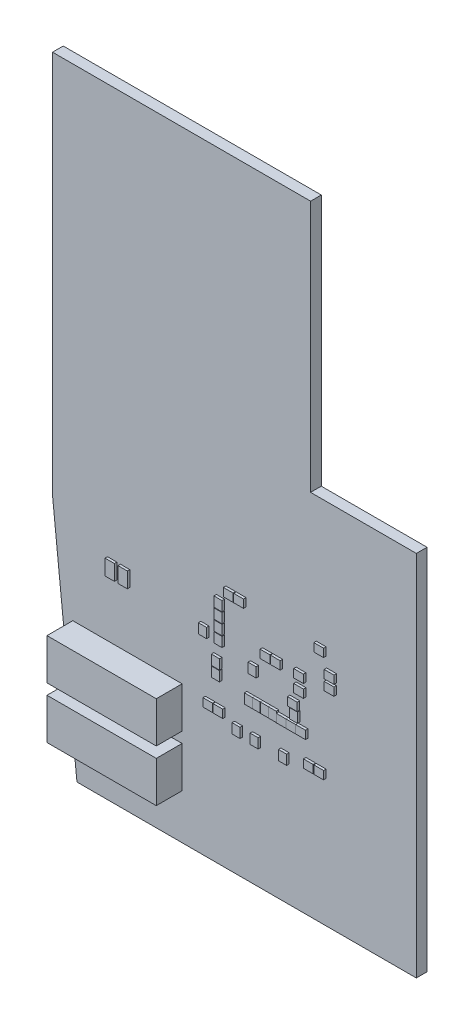
from build123d import *

# Parameters (mm, degrees)
BOARD_DEPTH                   = 2.6289
SKETCH2_W                     = 27.999944
SKETCH2_H                     = 27.999944
PBGA_324P_1MM_1_DEPTH         = 2.549906
SKETCH5_W                     = 7.20344
SKETCH5_H                     = 10.203434
SOT_223_1_DEPTH               = 1.778
SKETCH8_W                     = 12.003278
SKETCH8_H                     = 11.703304
HTSSOP_32P_0_65_1_DEPTH       = 2.649982
SKETCH53_W                    = 8.203184
SKETCH53_H                    = 5.803138
TSSOP_14P_0_65_1_DEPTH        = 1.100074
SKETCH54_W                    = 8.203184
SKETCH54_H                    = 5.803138
TSSOP_14P_0_65_2_DEPTH        = 1.100074
SKETCH57_W                    = 11.699748
SKETCH57_H                    = 9.699752
BGA_48P_0_8_1_DEPTH           = 0.999998
SKETCH58_W                    = 11.699748
SKETCH58_H                    = 9.699752
FBGA_48P_0_75_S_1_DEPTH       = 1.199896
SKETCH59_W                    = 13.700252
SKETCH59_H                    = 13.700252
FBGA_48P_0_75_1_DEPTH         = 1.35001
SKETCH60_W                    = 13.999972
SKETCH60_H                    = 13.999972
TFBGA_128P_0_8_1_DEPTH        = 1.199896
SKETCH62_W                    = 5.84327
SKETCH62_H                    = 8.279384
SO8_1_DEPTH                   = 1.75006
SKETCH66_W                    = 15.003272
SKETCH66_H                    = 14.203172
TQFP_44P_0_8_1_DEPTH          = 1.199896
SKETCH68_W                    = 5.84327
SKETCH68_H                    = 8.279384
SO8_2_DEPTH                   = 1.75006
SKETCH79_W                    = 13.999972
SKETCH79_H                    = 13.999972
TFBGA_128P_0_8_2_DEPTH        = 1.199896
SKETCH106_W                   = 8.279384
SKETCH106_H                   = 5.84327
SO8_3_DEPTH                   = 1.75006
SKETCH140_W                   = 3.854196
SKETCH140_H                   = 8.970264
TSSOP_8P_0_65_1_DEPTH         = 1.199896
SKETCH150_W                   = 7.403338
SKETCH150_H                   = 8.453374
TSSOP_20_0_65_1_DEPTH         = 1.199896
SKETCH151_W                   = 3.70332
SKETCH151_H                   = 6.703314
MSOP_10P_0_5_1_DEPTH          = 1.100074
SKETCH164_W                   = 42.203116
SKETCH164_H                   = 9.003284
CON_80P_0_8MM_QSE_SOC_1_DEPTH = 3.048
SKETCH165_W                   = 42.203116
SKETCH165_H                   = 9.003284
CON_80P_0_8MM_QSE_SOC_2_DEPTH = 3.048
CON_10P_100_RA_1_DEPTH        = 4.826
SKETCH171_W                   = 14.1732
SKETCH171_H                   = 19.8882
CON_14P_100_RA_1_DEPTH        = 4.826
SKETCH172_W                   = 14.203172
SKETCH172_H                   = 7.703312
DPAK_1_DEPTH                  = 2.54
SKETCH173_W                   = 7.703312
SKETCH173_H                   = 14.203172
DPAK_2_DEPTH                  = 2.54
SKETCH174_W                   = 6.453378
SKETCH174_H                   = 3.753358
MSOP_8P_0_65_1_DEPTH          = 1.100074
SKETCH175_W                   = 6.453378
SKETCH175_H                   = 3.753358
MSOP_8P_0_65_2_DEPTH          = 1.100074
SKETCH176_W                   = 6.453378
SKETCH176_H                   = 3.753358
MSOP_8P_0_65_3_DEPTH          = 1.100074
SKETCH177_W                   = 6.453378
SKETCH177_H                   = 3.753358
MSOP_8P_0_65_4_DEPTH          = 1.100074
SKETCH179_W                   = 8.279384
SKETCH179_H                   = 5.84327
SO8_4_DEPTH                   = 1.75006
SKETCH180_W                   = 2.303272
SKETCH180_H                   = 3.803396
SOT_553_5P_1_DEPTH            = 0.599948
SKETCH181_W                   = 2.303272
SKETCH181_H                   = 3.803396
SOT_553_5P_2_DEPTH            = 0.599948
SKETCH192_W                   = 4.903216
SKETCH192_H                   = 3.05308
RP_0402_16P_1_DEPTH           = 0.54991
SKETCH193_W                   = 4.903216
SKETCH193_H                   = 3.05308
RP_0402_16P_2_DEPTH           = 0.54991
SKETCH194_W                   = 3.05308
SKETCH194_H                   = 4.903216
RP_0402_16P_3_DEPTH           = 0.54991
SKETCH195_W                   = 3.05308
SKETCH195_H                   = 4.903216
RP_0402_16P_4_DEPTH           = 0.54991
SKETCH196_W                   = 3.05308
SKETCH196_H                   = 4.903216
RP_0402_16P_5_DEPTH           = 0.54991
SKETCH200_W                   = 7.403338
SKETCH200_H                   = 8.453374
TSSOP_20_0_65_2_DEPTH         = 1.199896
SKETCH201_W                   = 7.403338
SKETCH201_H                   = 8.453374
TSSOP_20_0_65_3_DEPTH         = 1.199896
SKETCH202_W                   = 7.403338
SKETCH202_H                   = 8.453374
TSSOP_20_0_65_4_DEPTH         = 1.199896
SKETCH203_W                   = 7.403338
SKETCH203_H                   = 8.453374
TSSOP_20_0_65_5_DEPTH         = 1.199896
SKETCH333_W                   = 2.003044
SKETCH333_H                   = 2.403348
EXTRUDE_C0306_1_DEPTH         = 0.610108
SKETCH334_W                   = 2.403348
SKETCH334_H                   = 2.003044
EXTRUDE_C0306_2_DEPTH         = 0.610108
SKETCH335_W                   = 2.403348
SKETCH335_H                   = 2.003044
EXTRUDE_C0306_3_DEPTH         = 0.610108
SKETCH336_W                   = 2.003044
SKETCH336_H                   = 2.403348
EXTRUDE_C0306_4_DEPTH         = 0.610108
SKETCH337_W                   = 2.003044
SKETCH337_H                   = 2.403348
EXTRUDE_C0306_5_DEPTH         = 0.610108
SKETCH338_W                   = 2.003044
SKETCH338_H                   = 2.403348
EXTRUDE_C0306_6_DEPTH         = 0.610108
SKETCH339_W                   = 2.003044
SKETCH339_H                   = 2.403348
EXTRUDE_C0306_7_DEPTH         = 0.610108
SKETCH340_W                   = 2.403348
SKETCH340_H                   = 2.003044
EXTRUDE_C0306_8_DEPTH         = 0.610108
SKETCH341_W                   = 2.403348
SKETCH341_H                   = 2.003044
EXTRUDE_C0306_9_DEPTH         = 0.610108
SKETCH342_W                   = 2.403348
SKETCH342_H                   = 2.003044
EXTRUDE_C0306_10_DEPTH        = 0.610108
SKETCH343_W                   = 2.003044
SKETCH343_H                   = 2.403348
EXTRUDE_C0306_11_DEPTH        = 0.610108
SKETCH344_W                   = 2.003044
SKETCH344_H                   = 2.403348
EXTRUDE_C0306_12_DEPTH        = 0.610108
SKETCH345_W                   = 2.403348
SKETCH345_H                   = 2.003044
EXTRUDE_C0306_13_DEPTH        = 0.610108
SKETCH346_W                   = 2.003044
SKETCH346_H                   = 2.403348
EXTRUDE_C0306_14_DEPTH        = 0.610108
SKETCH347_W                   = 2.003044
SKETCH347_H                   = 2.403348
EXTRUDE_C0306_15_DEPTH        = 0.610108
SKETCH348_W                   = 2.003044
SKETCH348_H                   = 2.403348
EXTRUDE_C0306_16_DEPTH        = 0.610108
SKETCH349_W                   = 2.403348
SKETCH349_H                   = 2.003044
EXTRUDE_C0306_17_DEPTH        = 0.610108
SKETCH350_W                   = 2.403348
SKETCH350_H                   = 2.003044
EXTRUDE_C0306_18_DEPTH        = 0.610108
SKETCH351_W                   = 2.403348
SKETCH351_H                   = 2.003044
EXTRUDE_C0306_19_DEPTH        = 0.610108
SKETCH352_W                   = 2.003044
SKETCH352_H                   = 2.403348
EXTRUDE_C0306_20_DEPTH        = 0.610108
SKETCH353_W                   = 2.403348
SKETCH353_H                   = 2.003044
EXTRUDE_C0306_21_DEPTH        = 0.610108
SKETCH354_W                   = 2.003044
SKETCH354_H                   = 2.403348
EXTRUDE_C0306_22_DEPTH        = 0.610108
SKETCH355_W                   = 2.403348
SKETCH355_H                   = 2.003044
EXTRUDE_C0306_23_DEPTH        = 0.610108
SKETCH356_W                   = 2.403348
SKETCH356_H                   = 2.003044
EXTRUDE_C0306_24_DEPTH        = 0.610108
SKETCH357_W                   = 2.403348
SKETCH357_H                   = 2.003044
EXTRUDE_C0306_25_DEPTH        = 0.610108
SKETCH358_W                   = 2.403348
SKETCH358_H                   = 2.003044
EXTRUDE_C0306_26_DEPTH        = 0.610108
SKETCH359_W                   = 2.403348
SKETCH359_H                   = 2.003044
EXTRUDE_C0306_27_DEPTH        = 0.610108
SKETCH360_W                   = 2.403348
SKETCH360_H                   = 2.003044
EXTRUDE_C0306_28_DEPTH        = 0.610108
SKETCH361_W                   = 2.403348
SKETCH361_H                   = 2.003044
EXTRUDE_C0306_29_DEPTH        = 0.610108
SKETCH362_W                   = 2.003044
SKETCH362_H                   = 2.403348
EXTRUDE_C0306_30_DEPTH        = 0.610108
SKETCH363_W                   = 2.003044
SKETCH363_H                   = 2.403348
EXTRUDE_C0306_31_DEPTH        = 0.610108
SKETCH364_W                   = 2.003044
SKETCH364_H                   = 2.403348
EXTRUDE_C0306_32_DEPTH        = 0.610108
SKETCH365_W                   = 2.003044
SKETCH365_H                   = 2.403348
EXTRUDE_C0306_33_DEPTH        = 0.610108
SKETCH407_W                   = 8.279384
SKETCH407_H                   = 5.84327
SO8_5_DEPTH                   = 1.75006
CON_6P_100_RA_1_DEPTH         = 4.1148
SKETCH419_W                   = 26.8732
SKETCH419_H                   = 10.0711
CON_38P_25_TE_1_DEPTH         = 6.35
SKETCH420_W                   = 26.8732
SKETCH420_H                   = 10.0711
CON_38P_25_TE_2_DEPTH         = 6.35


with BuildPart() as part:
    # Sketch1 → BOARD (new body)
    with BuildSketch(Plane.XY):
        Polygon((0, 152.4), (0, 57.999884), (5.999988, 0), (89.440004, 0), (89.440004, 90.400124), (63.440056, 90.400124), (63.440056, 152.4), align=None)
    extrude(amount=BOARD_DEPTH)


with BuildPart() as body_2:
    # Sketch2 → PBGA_324P_1MM-1 (new body)
    with BuildSketch(Plane.XY):
        with Locations((54.99989, 44.99991)):
            Rectangle(SKETCH2_W, SKETCH2_H)
    extrude(amount=-PBGA_324P_1MM_1_DEPTH)


with BuildPart() as body_3:
    # Sketch5 → SOT-223-1 (new body)
    with BuildSketch(Plane.XY):
        with Locations((78.74, 69.731001)):
            Rectangle(SKETCH5_W, SKETCH5_H)
    extrude(amount=-SOT_223_1_DEPTH)


with BuildPart() as body_4:
    # Sketch8 → HTSSOP_32P_0_65-1 (new body)
    with BuildSketch(Plane.XY):
        with Locations((38.100127, 131.500118)):
            Rectangle(SKETCH8_W, SKETCH8_H)
    extrude(amount=-HTSSOP_32P_0_65_1_DEPTH)


with BuildPart() as body_5:
    # Sketch53 → TSSOP_14P_0_65-1 (new body)
    with BuildSketch(Plane.XY):
        with Locations((29.595064, 38.050089)):
            Rectangle(SKETCH53_W, SKETCH53_H)
    extrude(amount=-TSSOP_14P_0_65_1_DEPTH)


with BuildPart() as body_6:
    # Sketch54 → TSSOP_14P_0_65-2 (new body)
    with BuildSketch(Plane.XY):
        with Locations((29.595064, 27.255089)):
            Rectangle(SKETCH54_W, SKETCH54_H)
    extrude(amount=-TSSOP_14P_0_65_2_DEPTH)


with BuildPart() as body_7:
    # Sketch57 → BGA_48P_0_8-1 (new body)
    with BuildSketch(Plane.XY):
        with Locations((81.000092, 17.999964)):
            Rectangle(SKETCH57_W, SKETCH57_H)
    extrude(amount=-BGA_48P_0_8_1_DEPTH)


with BuildPart() as body_8:
    # Sketch58 → FBGA_48P_0_75_S-1 (new body)
    with BuildSketch(Plane.XY):
        with Locations((81.000092, 44.99991)):
            Rectangle(SKETCH58_W, SKETCH58_H)
    extrude(amount=-FBGA_48P_0_75_S_1_DEPTH)


with BuildPart() as body_9:
    # Sketch59 → FBGA_48P_0_75-1 (new body)
    with BuildSketch(Plane.XY):
        with Locations((81.000092, 31.999936)):
            Rectangle(SKETCH59_W, SKETCH59_H)
    extrude(amount=-FBGA_48P_0_75_1_DEPTH)


with BuildPart() as body_10:
    # Sketch60 → TFBGA_128P_0_8-1 (new body)
    with BuildSketch(Plane.XY):
        with Locations((28.999942, 77.0001)):
            Rectangle(SKETCH60_W, SKETCH60_H)
    extrude(amount=-TFBGA_128P_0_8_1_DEPTH)


with BuildPart() as body_11:
    # Sketch62 → SO8-1 (new body)
    with BuildSketch(Plane.XY):
        with Locations((5.995035, 93.497908)):
            Rectangle(SKETCH62_W, SKETCH62_H)
    extrude(amount=-SO8_1_DEPTH)


with BuildPart() as body_12:
    # Sketch66 → TQFP_44P_0_8-1 (new body)
    with BuildSketch(Plane.XY):
        with Locations((24.53005, 56.515)):
            Rectangle(SKETCH66_W, SKETCH66_H)
    extrude(amount=-TQFP_44P_0_8_1_DEPTH)


with BuildPart() as body_13:
    # Sketch68 → SO8-2 (new body)
    with BuildSketch(Plane.XY):
        with Locations((56.869965, 94.462092)):
            Rectangle(SKETCH68_W, SKETCH68_H)
    extrude(amount=-SO8_2_DEPTH)


with BuildPart() as body_14:
    # Sketch79 → TFBGA_128P_0_8-2 (new body)
    with BuildSketch(Plane.XY):
        with Locations((50.999898, 77.0001)):
            Rectangle(SKETCH79_W, SKETCH79_H)
    extrude(amount=-TFBGA_128P_0_8_2_DEPTH)


with BuildPart() as body_15:
    # Sketch106 → SO8-3 (new body)
    with BuildSketch(Plane.XY):
        with Locations((33.982152, 108.779945)):
            Rectangle(SKETCH106_W, SKETCH106_H)
    extrude(amount=-SO8_3_DEPTH)


with BuildPart() as body_16:
    # Sketch140 → TSSOP_8P_0_65-1 (new body)
    with BuildSketch(Plane.XY):
        with Locations((34.059876, 53.05679)):
            Rectangle(SKETCH140_W, SKETCH140_H)
    extrude(amount=-TSSOP_8P_0_65_1_DEPTH)


with BuildPart() as body_17:
    # Sketch150 → TSSOP_20_0_65-1 (new body)
    with BuildSketch(Plane.XY):
        with Locations((70.385051, 8.630031)):
            Rectangle(SKETCH150_W, SKETCH150_H)
    extrude(amount=-TSSOP_20_0_65_1_DEPTH)


with BuildPart() as body_18:
    # Sketch151 → MSOP_10P_0_5-1 (new body)
    with BuildSketch(Plane.XY):
        with Locations((27.305, 16.259937)):
            Rectangle(SKETCH151_W, SKETCH151_H)
    extrude(amount=-MSOP_10P_0_5_1_DEPTH)


with BuildPart() as body_19:
    # Sketch164 → CON_80P_0_8MM_QSE_SOC-1 (new body)
    with BuildSketch(Plane.XY):
        with Locations((31.640018, 94.819978)):
            Rectangle(SKETCH164_W, SKETCH164_H)
    extrude(amount=-CON_80P_0_8MM_QSE_SOC_1_DEPTH)


with BuildPart() as body_20:
    # Sketch165 → CON_80P_0_8MM_QSE_SOC-2 (new body)
    with BuildSketch(Plane.XY):
        with Locations((43.720004, 6.700012)):
            Rectangle(SKETCH165_W, SKETCH165_H)
    extrude(amount=-CON_80P_0_8MM_QSE_SOC_2_DEPTH)


with BuildPart() as body_21:
    # Sketch170 → CON_10P_100_RA-1 (new body)
    with BuildSketch(Plane.XY):
        Polygon((0.698370082, 51.257474946), (-0.290302372, 65.396149743), (13.848372426, 66.384822197), (14.837044879, 52.246147399), align=None)
    extrude(amount=-CON_10P_100_RA_1_DEPTH)


with BuildPart() as body_22:
    # Sketch171 → CON_14P_100_RA-1 (new body)
    with BuildSketch(Plane.XY):
        with Locations((6.985, 77.7875)):
            Rectangle(SKETCH171_W, SKETCH171_H)
    extrude(amount=-CON_14P_100_RA_1_DEPTH)


with BuildPart() as body_23:
    # Sketch172 → DPAK-1 (new body)
    with BuildSketch(Plane.XY):
        with Locations((43.749976, 120.000014)):
            Rectangle(SKETCH172_W, SKETCH172_H)
    extrude(amount=-DPAK_1_DEPTH)


with BuildPart() as body_24:
    # Sketch173 → DPAK-2 (new body)
    with BuildSketch(Plane.XY):
        with Locations((21.500084, 133.75005)):
            Rectangle(SKETCH173_W, SKETCH173_H)
    extrude(amount=-DPAK_2_DEPTH)


with BuildPart() as body_25:
    # Sketch174 → MSOP_8P_0_65-1 (new body)
    with BuildSketch(Plane.XY):
        with Locations((82.874993, 80.035019)):
            Rectangle(SKETCH174_W, SKETCH174_H)
    extrude(amount=-MSOP_8P_0_65_1_DEPTH)


with BuildPart() as body_26:
    # Sketch175 → MSOP_8P_0_65-2 (new body)
    with BuildSketch(Plane.XY):
        with Locations((82.874993, 85.115019)):
            Rectangle(SKETCH175_W, SKETCH175_H)
    extrude(amount=-MSOP_8P_0_65_2_DEPTH)


with BuildPart() as body_27:
    # Sketch176 → MSOP_8P_0_65-3 (new body)
    with BuildSketch(Plane.XY):
        with Locations((71.444993, 80.035019)):
            Rectangle(SKETCH176_W, SKETCH176_H)
    extrude(amount=-MSOP_8P_0_65_3_DEPTH)


with BuildPart() as body_28:
    # Sketch177 → MSOP_8P_0_65-4 (new body)
    with BuildSketch(Plane.XY):
        with Locations((71.444993, 85.115019)):
            Rectangle(SKETCH177_W, SKETCH177_H)
    extrude(amount=-MSOP_8P_0_65_4_DEPTH)


with BuildPart() as body_29:
    # Sketch179 → SO8-4 (new body)
    with BuildSketch(Plane.XY):
        with Locations((4.977892, 135.449945)):
            Rectangle(SKETCH179_W, SKETCH179_H)
    extrude(amount=-SO8_4_DEPTH)


with BuildPart() as body_30:
    # Sketch180 → SOT_553_5P-1 (new body)
    with BuildSketch(Plane.XY.offset(2.6289)):
        with Locations((14.655038, 49.829974)):
            Rectangle(SKETCH180_W, SKETCH180_H)
    extrude(amount=SOT_553_5P_1_DEPTH)


with BuildPart() as body_31:
    # Sketch181 → SOT_553_5P-2 (new body)
    with BuildSketch(Plane.XY.offset(2.6289)):
        with Locations((17.830038, 49.829974)):
            Rectangle(SKETCH181_W, SKETCH181_H)
    extrude(amount=SOT_553_5P_2_DEPTH)


with BuildPart() as body_32:
    # Sketch192 → RP_0402_16P-1 (new body)
    with BuildSketch(Plane.XY):
        with Locations((66.675, 28.984956)):
            Rectangle(SKETCH192_W, SKETCH192_H)
    extrude(amount=-RP_0402_16P_1_DEPTH)


with BuildPart() as body_33:
    # Sketch193 → RP_0402_16P-2 (new body)
    with BuildSketch(Plane.XY):
        with Locations((61.595, 28.730956)):
            Rectangle(SKETCH193_W, SKETCH193_H)
    extrude(amount=-RP_0402_16P_2_DEPTH)


with BuildPart() as body_34:
    # Sketch194 → RP_0402_16P-3 (new body)
    with BuildSketch(Plane.XY):
        with Locations((71.980044, 42.545)):
            Rectangle(SKETCH194_W, SKETCH194_H)
    extrude(amount=-RP_0402_16P_3_DEPTH)


with BuildPart() as body_35:
    # Sketch195 → RP_0402_16P-4 (new body)
    with BuildSketch(Plane.XY):
        with Locations((71.980044, 37.465)):
            Rectangle(SKETCH195_W, SKETCH195_H)
    extrude(amount=-RP_0402_16P_4_DEPTH)


with BuildPart() as body_36:
    # Sketch196 → RP_0402_16P-5 (new body)
    with BuildSketch(Plane.XY):
        with Locations((71.980044, 47.625)):
            Rectangle(SKETCH196_W, SKETCH196_H)
    extrude(amount=-RP_0402_16P_5_DEPTH)


with BuildPart() as body_37:
    # Sketch200 → TSSOP_20_0_65-2 (new body)
    with BuildSketch(Plane.XY):
        with Locations((36.730051, 18.790031)):
            Rectangle(SKETCH200_W, SKETCH200_H)
    extrude(amount=-TSSOP_20_0_65_2_DEPTH)


with BuildPart() as body_38:
    # Sketch201 → TSSOP_20_0_65-3 (new body)
    with BuildSketch(Plane.XY):
        with Locations((53.240051, 18.790031)):
            Rectangle(SKETCH201_W, SKETCH201_H)
    extrude(amount=-TSSOP_20_0_65_3_DEPTH)


with BuildPart() as body_39:
    # Sketch202 → TSSOP_20_0_65-4 (new body)
    with BuildSketch(Plane.XY):
        with Locations((44.985051, 18.790031)):
            Rectangle(SKETCH202_W, SKETCH202_H)
    extrude(amount=-TSSOP_20_0_65_4_DEPTH)


with BuildPart() as body_40:
    # Sketch203 → TSSOP_20_0_65-5 (new body)
    with BuildSketch(Plane.XY):
        with Locations((61.495051, 18.790031)):
            Rectangle(SKETCH203_W, SKETCH203_H)
    extrude(amount=-TSSOP_20_0_65_5_DEPTH)


with BuildPart() as body_41:
    # Sketch333 → C0306-1 (new body)
    with BuildSketch(Plane.XY.offset(2.6289)):
        with Locations((49.657, 45.974)):
            Rectangle(SKETCH333_W, SKETCH333_H)
    extrude(amount=EXTRUDE_C0306_1_DEPTH)


with BuildPart() as body_42:
    # Sketch334 → C0306-2 (new body)
    with BuildSketch(Plane.XY.offset(2.6289)):
        with Locations((68.58, 51.435)):
            Rectangle(SKETCH334_W, SKETCH334_H)
    extrude(amount=EXTRUDE_C0306_2_DEPTH)


with BuildPart() as body_43:
    # Sketch335 → C0306-3 (new body)
    with BuildSketch(Plane.XY.offset(2.6289)):
        with Locations((59.563, 43.688)):
            Rectangle(SKETCH335_W, SKETCH335_H)
    extrude(amount=EXTRUDE_C0306_3_DEPTH)


with BuildPart() as body_44:
    # Sketch336 → C0306-4 (new body)
    with BuildSketch(Plane.XY.offset(2.6289)):
        with Locations((54.61, 38.989)):
            Rectangle(SKETCH336_W, SKETCH336_H)
    extrude(amount=EXTRUDE_C0306_4_DEPTH)


with BuildPart() as body_45:
    # Sketch337 → C0306-5 (new body)
    with BuildSketch(Plane.XY.offset(2.6289)):
        with Locations((50.673, 38.989)):
            Rectangle(SKETCH337_W, SKETCH337_H)
    extrude(amount=EXTRUDE_C0306_5_DEPTH)


with BuildPart() as body_46:
    # Sketch338 → C0306-6 (new body)
    with BuildSketch(Plane.XY.offset(2.6289)):
        with Locations((48.768, 38.989)):
            Rectangle(SKETCH338_W, SKETCH338_H)
    extrude(amount=EXTRUDE_C0306_6_DEPTH)


with BuildPart() as body_47:
    # Sketch339 → C0306-7 (new body)
    with BuildSketch(Plane.XY.offset(2.6289)):
        with Locations((59.817, 41.402)):
            Rectangle(SKETCH339_W, SKETCH339_H)
    extrude(amount=EXTRUDE_C0306_7_DEPTH)


with BuildPart() as body_48:
    # Sketch340 → C0306-8 (new body)
    with BuildSketch(Plane.XY.offset(2.6289)):
        with Locations((59.182, 38.735)):
            Rectangle(SKETCH340_W, SKETCH340_H)
    extrude(amount=EXTRUDE_C0306_8_DEPTH)


with BuildPart() as body_49:
    # Sketch341 → C0306-9 (new body)
    with BuildSketch(Plane.XY.offset(2.6289)):
        with Locations((56.769, 38.735)):
            Rectangle(SKETCH341_W, SKETCH341_H)
    extrude(amount=EXTRUDE_C0306_9_DEPTH)


with BuildPart() as body_50:
    # Sketch342 → C0306-10 (new body)
    with BuildSketch(Plane.XY.offset(2.6289)):
        with Locations((43.815, 59.055)):
            Rectangle(SKETCH342_W, SKETCH342_H)
    extrude(amount=EXTRUDE_C0306_10_DEPTH)


with BuildPart() as body_51:
    # Sketch343 → C0306-11 (new body)
    with BuildSketch(Plane.XY.offset(2.6289)):
        with Locations((41.275, 50.8)):
            Rectangle(SKETCH343_W, SKETCH343_H)
    extrude(amount=EXTRUDE_C0306_11_DEPTH)


with BuildPart() as body_52:
    # Sketch344 → C0306-12 (new body)
    with BuildSketch(Plane.XY.offset(2.6289)):
        with Locations((41.275, 55.88)):
            Rectangle(SKETCH344_W, SKETCH344_H)
    extrude(amount=EXTRUDE_C0306_12_DEPTH)


with BuildPart() as body_53:
    # Sketch345 → C0306-13 (new body)
    with BuildSketch(Plane.XY.offset(2.6289)):
        with Locations((68.58, 53.975)):
            Rectangle(SKETCH345_W, SKETCH345_H)
    extrude(amount=EXTRUDE_C0306_13_DEPTH)


with BuildPart() as body_54:
    # Sketch346 → C0306-14 (new body)
    with BuildSketch(Plane.XY.offset(2.6289)):
        with Locations((57.15, 31.115)):
            Rectangle(SKETCH346_W, SKETCH346_H)
    extrude(amount=EXTRUDE_C0306_14_DEPTH)


with BuildPart() as body_55:
    # Sketch347 → C0306-15 (new body)
    with BuildSketch(Plane.XY.offset(2.6289)):
        with Locations((40.64, 40.64)):
            Rectangle(SKETCH347_W, SKETCH347_H)
    extrude(amount=EXTRUDE_C0306_15_DEPTH)


with BuildPart() as body_56:
    # Sketch348 → C0306-16 (new body)
    with BuildSketch(Plane.XY.offset(2.6289)):
        with Locations((45.72, 31.115)):
            Rectangle(SKETCH348_W, SKETCH348_H)
    extrude(amount=EXTRUDE_C0306_16_DEPTH)


with BuildPart() as body_57:
    # Sketch349 → C0306-17 (new body)
    with BuildSketch(Plane.XY.offset(2.6289)):
        with Locations((63.5, 32.385)):
            Rectangle(SKETCH349_W, SKETCH349_H)
    extrude(amount=EXTRUDE_C0306_17_DEPTH)


with BuildPart() as body_58:
    # Sketch350 → C0306-18 (new body)
    with BuildSketch(Plane.XY.offset(2.6289)):
        with Locations((52.832, 50.419)):
            Rectangle(SKETCH350_W, SKETCH350_H)
    extrude(amount=EXTRUDE_C0306_18_DEPTH)


with BuildPart() as body_59:
    # Sketch351 → C0306-19 (new body)
    with BuildSketch(Plane.XY.offset(2.6289)):
        with Locations((55.372, 50.419)):
            Rectangle(SKETCH351_W, SKETCH351_H)
    extrude(amount=EXTRUDE_C0306_19_DEPTH)


with BuildPart() as body_60:
    # Sketch352 → C0306-20 (new body)
    with BuildSketch(Plane.XY.offset(2.6289)):
        with Locations((37.465, 48.26)):
            Rectangle(SKETCH352_W, SKETCH352_H)
    extrude(amount=EXTRUDE_C0306_20_DEPTH)


with BuildPart() as body_61:
    # Sketch353 → C0306-21 (new body)
    with BuildSketch(Plane.XY.offset(2.6289)):
        with Locations((66.04, 58.42)):
            Rectangle(SKETCH353_W, SKETCH353_H)
    extrude(amount=EXTRUDE_C0306_21_DEPTH)


with BuildPart() as body_62:
    # Sketch354 → C0306-22 (new body)
    with BuildSketch(Plane.XY.offset(2.6289)):
        with Locations((41.275, 53.34)):
            Rectangle(SKETCH354_W, SKETCH354_H)
    extrude(amount=EXTRUDE_C0306_22_DEPTH)


with BuildPart() as body_63:
    # Sketch355 → C0306-23 (new body)
    with BuildSketch(Plane.XY.offset(2.6289)):
        with Locations((46.355, 59.055)):
            Rectangle(SKETCH355_W, SKETCH355_H)
    extrude(amount=EXTRUDE_C0306_23_DEPTH)


with BuildPart() as body_64:
    # Sketch356 → C0306-24 (new body)
    with BuildSketch(Plane.XY.offset(2.6289)):
        with Locations((61.087, 50.419)):
            Rectangle(SKETCH356_W, SKETCH356_H)
    extrude(amount=EXTRUDE_C0306_24_DEPTH)


with BuildPart() as body_65:
    # Sketch357 → C0306-25 (new body)
    with BuildSketch(Plane.XY.offset(2.6289)):
        with Locations((38.7858, 33.0708)):
            Rectangle(SKETCH357_W, SKETCH357_H)
    extrude(amount=EXTRUDE_C0306_25_DEPTH)


with BuildPart() as body_66:
    # Sketch358 → C0306-26 (new body)
    with BuildSketch(Plane.XY.offset(2.6289)):
        with Locations((41.2496, 33.0454)):
            Rectangle(SKETCH358_W, SKETCH358_H)
    extrude(amount=EXTRUDE_C0306_26_DEPTH)


with BuildPart() as body_67:
    # Sketch359 → C0306-27 (new body)
    with BuildSketch(Plane.XY.offset(2.6289)):
        with Locations((66.04, 32.385)):
            Rectangle(SKETCH359_W, SKETCH359_H)
    extrude(amount=EXTRUDE_C0306_27_DEPTH)


with BuildPart() as body_68:
    # Sketch360 → C0306-28 (new body)
    with BuildSketch(Plane.XY.offset(2.6289)):
        with Locations((61.595, 38.735)):
            Rectangle(SKETCH360_W, SKETCH360_H)
    extrude(amount=EXTRUDE_C0306_28_DEPTH)


with BuildPart() as body_69:
    # Sketch361 → C0306-29 (new body)
    with BuildSketch(Plane.XY.offset(2.6289)):
        with Locations((61.087, 47.244)):
            Rectangle(SKETCH361_W, SKETCH361_H)
    extrude(amount=EXTRUDE_C0306_29_DEPTH)


with BuildPart() as body_70:
    # Sketch362 → C0306-30 (new body)
    with BuildSketch(Plane.XY.offset(2.6289)):
        with Locations((40.64, 43.18)):
            Rectangle(SKETCH362_W, SKETCH362_H)
    extrude(amount=EXTRUDE_C0306_30_DEPTH)


with BuildPart() as body_71:
    # Sketch363 → C0306-31 (new body)
    with BuildSketch(Plane.XY.offset(2.6289)):
        with Locations((50.165, 31.115)):
            Rectangle(SKETCH363_W, SKETCH363_H)
    extrude(amount=EXTRUDE_C0306_31_DEPTH)


with BuildPart() as body_72:
    # Sketch364 → C0306-32 (new body)
    with BuildSketch(Plane.XY.offset(2.6289)):
        with Locations((52.705, 38.989)):
            Rectangle(SKETCH364_W, SKETCH364_H)
    extrude(amount=EXTRUDE_C0306_32_DEPTH)


with BuildPart() as body_73:
    # Sketch365 → C0306-33 (new body)
    with BuildSketch(Plane.XY.offset(2.6289)):
        with Locations((41.275, 48.26)):
            Rectangle(SKETCH365_W, SKETCH365_H)
    extrude(amount=EXTRUDE_C0306_33_DEPTH)


with BuildPart() as body_74:
    # Sketch407 → SO8-5 (new body)
    with BuildSketch(Plane.XY):
        with Locations((18.897092, 44.730035)):
            Rectangle(SKETCH407_W, SKETCH407_H)
    extrude(amount=-SO8_5_DEPTH)


with BuildPart() as body_75:
    # Sketch418 → CON_6P_100_RA-1 (new body)
    with BuildSketch(Plane.XY):
        Polygon((2.634506762, 33.824660064), (1.020252798, 49.183260598), (13.852767719, 50.532012266), (15.467021683, 35.173411731), align=None)
    extrude(amount=-CON_6P_100_RA_1_DEPTH)


with BuildPart() as body_76:
    # Sketch419 → CON_38P_25_TE-1 (new body)
    with BuildSketch(Plane.XY.offset(2.6289)):
        with Locations((18.415, 28.80995)):
            Rectangle(SKETCH419_W, SKETCH419_H)
    extrude(amount=CON_38P_25_TE_1_DEPTH)


with BuildPart() as body_77:
    # Sketch420 → CON_38P_25_TE-2 (new body)
    with BuildSketch(Plane.XY.offset(2.6289)):
        with Locations((18.415, 16.10995)):
            Rectangle(SKETCH420_W, SKETCH420_H)
    extrude(amount=CON_38P_25_TE_2_DEPTH)


solid = Compound([part.part, body_2.part, body_3.part, body_4.part, body_5.part, body_6.part, body_7.part, body_8.part, body_9.part, body_10.part, body_11.part, body_12.part, body_13.part, body_14.part, body_15.part, body_16.part, body_17.part, body_18.part, body_19.part, body_20.part, body_21.part, body_22.part, body_23.part, body_24.part, body_25.part, body_26.part, body_27.part, body_28.part, body_29.part, body_30.part, body_31.part, body_32.part, body_33.part, body_34.part, body_35.part, body_36.part, body_37.part, body_38.part, body_39.part, body_40.part, body_41.part, body_42.part, body_43.part, body_44.part, body_45.part, body_46.part, body_47.part, body_48.part, body_49.part, body_50.part, body_51.part, body_52.part, body_53.part, body_54.part, body_55.part, body_56.part, body_57.part, body_58.part, body_59.part, body_60.part, body_61.part, body_62.part, body_63.part, body_64.part, body_65.part, body_66.part, body_67.part, body_68.part, body_69.part, body_70.part, body_71.part, body_72.part, body_73.part, body_74.part, body_75.part, body_76.part, body_77.part])
